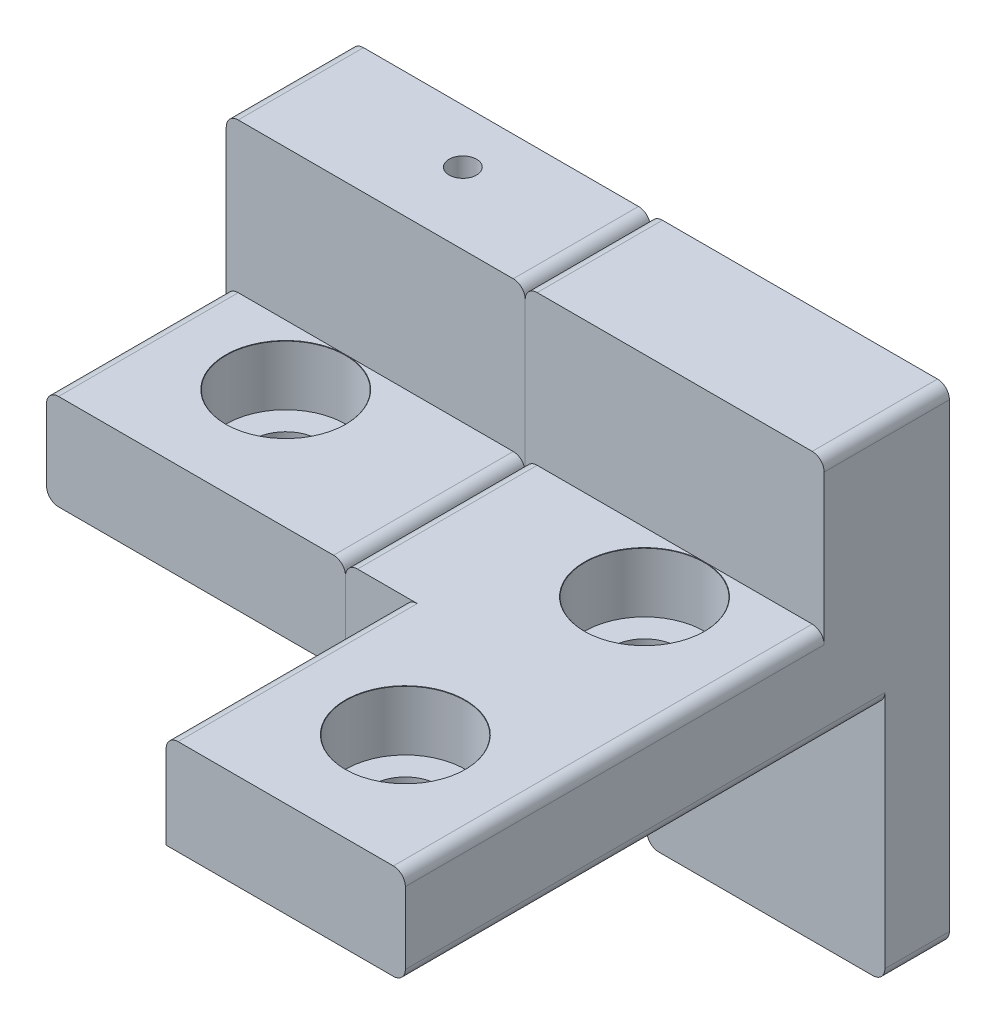
from build123d import *

# Parameters (mm, degrees)
BOSS_EXTRUDE1_DEPTH            = 8
CBORE_FOR_M5_SHCS1_AT_2_COUNT  = 2
CBORE_FOR_M5_SHCS1_AT_2_PITCH  = 20
SKETCH5_W                      = 25
SKETCH5_H                      = 2.975
BOSS_EXTRUDE2_DEPTH            = 12.51
SKETCH6_W                      = 3
SKETCH6_H                      = 8.01
BOSS_EXTRUDE3_DEPTH            = 7.5
BOSS_EXTRUDE4_DEPTH            = 5.5
SKETCH8_W                      = 17
SKETCH8_H                      = 1.25
BOSS_EXTRUDE5_DEPTH            = 7.5
BOSS_EXTRUDE6_DEPTH            = 5.4
FILLET2_R                      = 1
CBORE_START                    = -40
CBORE_FOR_M3_SHCS1_OUTLINE_R   = 3.25
CBORE_FOR_M3_SHCS1_DEPTH       = 3
CBORE_START_2                  = -37
CBORE_FOR_M3_SHCS1_2_OUTLINE_R = 1.8
CBORE_FOR_M3_SHCS1_2_DEPTH     = 2
SKETCH13_R                     = 2.35
CUT_EXTRUDE1_DEPTH             = 3.8
SKETCH14_R                     = 1.65
CUT_EXTRUDE2_DEPTH             = 3
SKETCH15_W                     = 20
SKETCH15_H                     = 20
CUT_EXTRUDE3_DEPTH             = 52.680848484
SKETCH16_R                     = 1.15
CUT_EXTRUDE4_DEPTH             = 2.5


# Read off the part's stored shape, not the designer's step: CBORE for M3 SHCS1
with BuildPart() as part:
    # Sketch1 → Boss-Extrude1 (new body)
    with BuildSketch(Plane(origin=(0, 0, 0), x_dir=(1, 0, 0), z_dir=(0, 1, 0))):
        Polygon((-10, 0), (-15, 0), (-15, 20), (-10, 20), (10, 20), (10, -20), (-10, -20), align=None)
    extrude(amount=BOSS_EXTRUDE1_DEPTH)

    # Sketch4 → CBORE for M5 SHCS1 (revolve, cut)
    with BuildSketch(Plane(origin=(0, 8, -10), x_dir=(0, 0, 1), z_dir=(1, 0, 0))):
        Polygon((0, 0), (0, 8), (2.75, 8), (2.75, 5), (5, 5), (5, 0.025), (5.025, 0), align=None)
    cbore_for_m5_shcs1 = revolve(axis=Axis((0, 14.35, -10), (0, -1, 0)), mode=Mode.SUBTRACT)

    # CBORE for M5 SHCS1 at 2: CBORE for M5 SHCS1 ×2
    with Locations(*[(0, 0, i * CBORE_FOR_M5_SHCS1_AT_2_PITCH) for i in range(1, CBORE_FOR_M5_SHCS1_AT_2_COUNT)]):
        add(cbore_for_m5_shcs1, mode=Mode.SUBTRACT)

    # Sketch5 → Boss-Extrude2 (add)
    with BuildSketch(Plane(origin=(0, 8, 0), x_dir=(1, 0, 0), z_dir=(0, 1, 0))):
        with Locations((-2.5, 16.5125)):
            Rectangle(SKETCH5_W, SKETCH5_H)
    extrude(amount=BOSS_EXTRUDE2_DEPTH)

    # Sketch6 → Boss-Extrude3 (add)
    with BuildSketch(Plane(origin=(0, 0, -18), x_dir=(-1, 0, 0), z_dir=(0, 0, -1))):
        Polygon((-10, 20.51), (15, 20.51), (15, 17.51), (-5, 17.51), (-5, 8), (-10, 8), (-10, 20), align=None)
        with Locations((13.5, 12.005)):
            Rectangle(SKETCH6_W, SKETCH6_H)
    extrude(amount=BOSS_EXTRUDE3_DEPTH)

    # Sketch7 → Boss-Extrude4 (add)
    with BuildSketch(Plane(origin=(0, 0, -20), x_dir=(-1, 0, 0), z_dir=(0, 0, -1))):
        Polygon((-10, 0), (15, 0), (15, 8), (12, 8), (-5, 8), (-10, 8), align=None)
    extrude(amount=BOSS_EXTRUDE4_DEPTH)

    # Sketch8 → Boss-Extrude5 (add)
    with BuildSketch(Plane(origin=(0, 0, -18), x_dir=(-1, 0, 0), z_dir=(0, 0, -1))):
        with Locations((3.5, 8.625)):
            Rectangle(SKETCH8_W, SKETCH8_H)
    extrude(amount=BOSS_EXTRUDE5_DEPTH)

    # Sketch9 → Boss-Extrude6 (add)
    with BuildSketch(Plane(origin=(0, 0, -25.5), x_dir=(-1, 0, 0), z_dir=(0, 0, -1))):
        Polygon((-10, 0), (15, 0), (15, -5.4), (9.9, -5.4), (9.9, -20), (-10, -20), align=None)
    extrude(amount=-BOSS_EXTRUDE6_DEPTH)

    # Fillet2
    fillet2_edges = [part.edges().sort_by_distance(p)[0] for p in [
        (10, 0, -0.05),
        (-15, 0, -10.05),
        (10, -20, -22.8),
        (-15, -5.4, -22.8),
        (-9.9, -20, -22.8),
        (-10, 8, 10),
        (-15, 8, -7.5125),
        (-15, 20.51, -20.2625),
        (10, 20.51, -20.2625),
        (10, 8, 2.4875),
    ]]
    fillet(fillet2_edges, radius=FILLET2_R)


with BuildPart() as body_2:
    # Mirror1: mirrored copy
    add(part.part.mirror(Plane(origin=(-15, 8, 0), x_dir=(0, 0, 1), z_dir=(1, 0, 0))))

    # CBORE for M3 SHCS1 outline → CBORE for M3 SHCS1 (cut)
    with BuildSketch(Plane.YZ.offset(CBORE_START)):
        with Locations((12.68, -21.5)):
            Circle(CBORE_FOR_M3_SHCS1_OUTLINE_R)
    extrude(amount=CBORE_FOR_M3_SHCS1_DEPTH, mode=Mode.SUBTRACT)

    # CBORE for M3 SHCS1 2 outline → CBORE for M3 SHCS1 2 (cut)
    with BuildSketch(Plane.YZ.offset(CBORE_START_2)):
        with Locations((12.68, -21.5)):
            Circle(CBORE_FOR_M3_SHCS1_2_OUTLINE_R)
    extrude(amount=CBORE_FOR_M3_SHCS1_2_DEPTH, mode=Mode.SUBTRACT)

    # Sketch13 → Cut-Extrude1 (cut)
    with BuildSketch(Plane(origin=(0, 0, -25.5), x_dir=(-1, 0, 0), z_dir=(0, 0, -1))):
        with Locations((20, 4)):
            Circle(SKETCH13_R)
        with Locations((35, 4)):
            Circle(SKETCH13_R)
    extrude(amount=-CUT_EXTRUDE1_DEPTH, mode=Mode.SUBTRACT)

    # Sketch14 → Cut-Extrude2 (cut)
    with BuildSketch(Plane(origin=(0, 0, -21.7), x_dir=(-1, 0, 0), z_dir=(0, 0, -1))):
        with Locations((35, 4)):
            Circle(SKETCH14_R)
        with Locations((20, 4)):
            Circle(SKETCH14_R)
    extrude(amount=-CUT_EXTRUDE2_DEPTH, mode=Mode.SUBTRACT)

    # Sketch15 → Cut-Extrude3 (cut, through all)
    with BuildSketch(Plane.XZ):
        with Locations((-30, 10)):
            Rectangle(SKETCH15_W, SKETCH15_H)
    extrude(amount=-CUT_EXTRUDE3_DEPTH, mode=Mode.SUBTRACT)

    # Sketch16 → Cut-Extrude4 (cut, symmetric)
    with BuildSketch(Plane(origin=(0, 20.51, 0), x_dir=(1, 0, 0), z_dir=(0, 1, 0))):
        with Locations(Location((-26.19, 21, 0), (0, 0, 270))):
            Circle(SKETCH16_R)
    extrude(amount=CUT_EXTRUDE4_DEPTH, both=True, mode=Mode.SUBTRACT)


solid = Compound([part.part, body_2.part])
